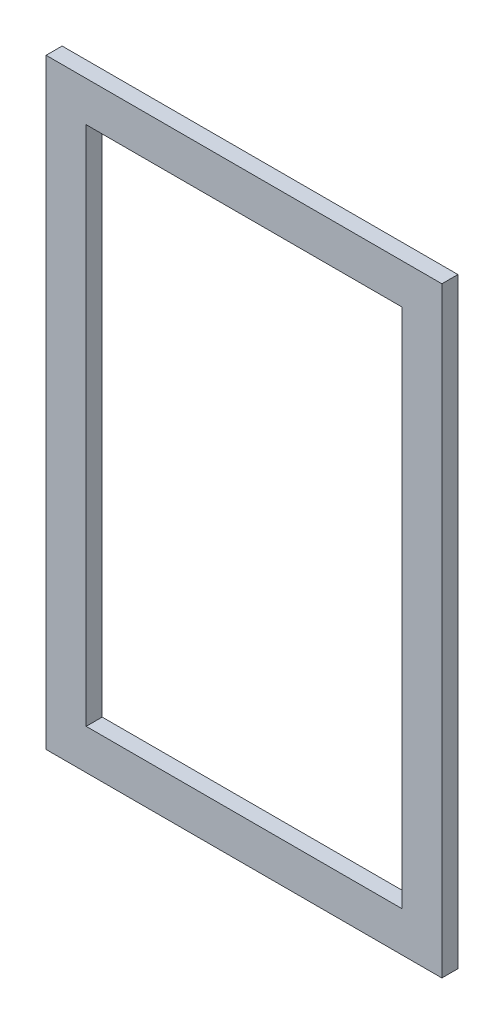
from build123d import *

# Parameters (mm, degrees)
BOTTOM_PLATE_START     = -335.008892233
BOTTOM_PLATE_OUTLINE_W = 600
BOTTOM_PLATE_OUTLINE_H = 16
BOTTOM_PLATE_DEPTH     = 395
SKETCH1_W              = 315
SKETCH1_H              = 520
CUT_EXTRUDE1_DEPTH     = 516.485669921


# Read off the part's stored shape, not the designer's step: bottom-plate
with BuildPart() as part:
    # bottom-plate outline → bottom-plate (new body)
    with BuildSketch(Plane.YZ.offset(BOTTOM_PLATE_START)):
        with Locations((91.456917194, 326.460719179)):
            Rectangle(BOTTOM_PLATE_OUTLINE_W, BOTTOM_PLATE_OUTLINE_H)
    extrude(amount=BOTTOM_PLATE_DEPTH)

    # Sketch1 → Cut-Extrude1 (cut, through all)
    with BuildSketch(Plane.XY.offset(334.460719179)):
        with Locations((-137.508892233, 91.456917194)):
            Rectangle(SKETCH1_W, SKETCH1_H)
    extrude(amount=-CUT_EXTRUDE1_DEPTH, mode=Mode.SUBTRACT)


solid = part.part
